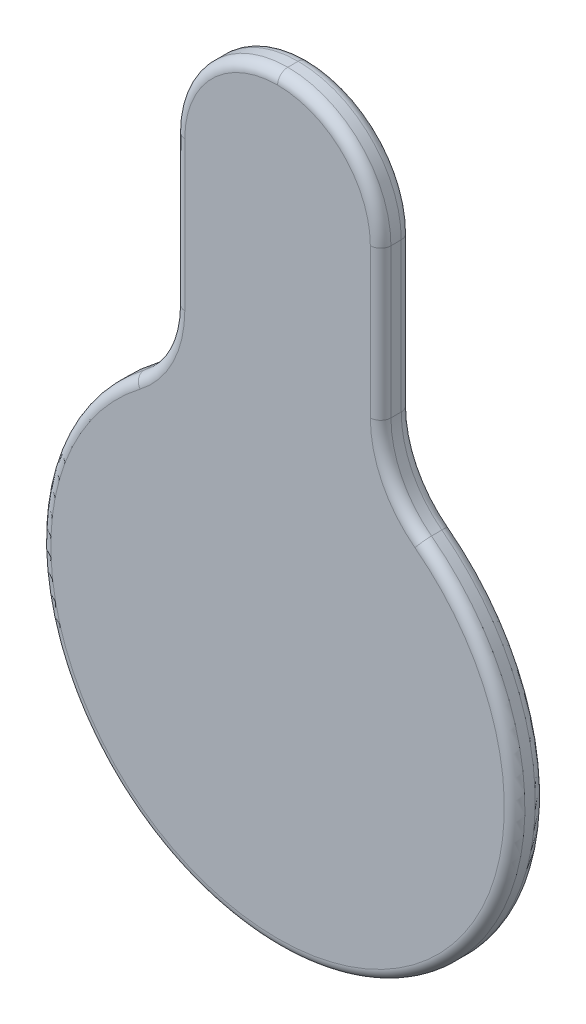
from build123d import *

# Parameters (mm, degrees)
SKETCH1_R           = 58.42
BOSS_EXTRUDE1_DEPTH = 7.62
FILLET1_R           = 25.4
FILLET2_R           = 25.4
FILLET3_R           = 2.54


with BuildPart() as part:
    # Sketch1 → Boss-Extrude1 (new body)
    with BuildSketch(Plane.XY):
        Circle(SKETCH1_R)
        with BuildLine():
            Line((25.4, 52.60928055), (25.4, 128.80928055))
            Line((25.4, 128.80928055), (-25.4, 128.80928055))
            Line((-25.4, 128.80928055), (-25.4, 52.60928055))
            ThreePointArc((-25.4, 52.60928055), (0, 58.42), (25.4, 52.60928055))
        make_face()
    extrude(amount=BOSS_EXTRUDE1_DEPTH)

    # Fillet1
    fillet1_edges = [part.edges().sort_by_distance(p)[0] for p in [
        (-25.4, 128.80928055, 3.81),
        (25.4, 128.80928055, 3.81),
    ]]
    fillet(fillet1_edges, radius=FILLET1_R - 0.0001)  # a hair under: the kernel refuses the full size

    # Fillet2
    fillet2_edges = [part.edges().sort_by_distance(p)[0] for p in [
        (-25.4, 52.60928055, 3.81),
        (25.4, 52.60928055, 3.81),
    ]]
    fillet(fillet2_edges, radius=FILLET2_R)

    # Fillet3
    fillet3_edges = [part.edges().sort_by_distance(p)[0] for p in [
        (-25.4, 85.040678336, 0),
        (-25.4, 85.040678336, 7.62),
        (25.4, 85.040678336, 0),
        (17.960541531, 121.369822082, 0),
        (-17.960541531, 121.369822082, 0),
        (25.4, 85.040678336, 7.62),
        (17.960541531, 121.369822082, 7.62),
        (-17.960541531, 121.369822082, 7.62),
        (0, -58.42, 0),
        (0, -58.42, 7.62),
        (28.038562649, 55.399133992, 0),
        (28.038562649, 55.399133992, 7.62),
        (-28.038562649, 55.399133992, 0),
        (-28.038562649, 55.399133992, 7.62),
    ]]
    fillet(fillet3_edges, radius=FILLET3_R)


solid = part.part
